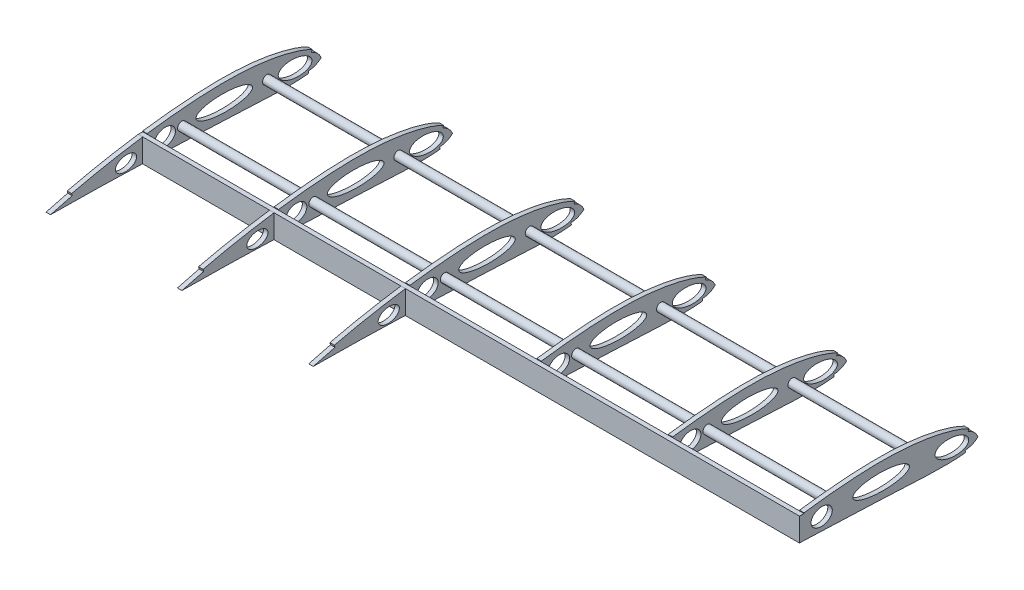
from build123d import *

# Parameters (mm, degrees)
SKETCH2_R           = 3
SPARS_DEPTH         = 467
SPARS_2_DEPTH       = 467
SKETCH2_9_R         = 3
SKETCH2_9_RX        = 20
SKETCH2_9_RY        = 6.002165883
SKETCH2_9_RX_2      = 12
SKETCH2_9_RY_2      = 6
SKETCH2_9_RX_3      = 7.5
SKETCH2_9_RY_3      = 5
BASE_WING_DEPTH     = 3.175
LPATTERN7_COUNT     = 3
LPATTERN7_PITCH     = 92.765
TRAILING_EDGE_DEPTH = 3.175
LEADING_EDGE_DEPTH  = 3.175
LPATTERN8_COUNT     = 3
LPATTERN8_PITCH     = 92.765
SKETCH2_10_W        = 3.17
SKETCH2_10_H        = 6.35
FACE_2_DEPTH        = 3.175
LPATTERN9_COUNT     = 3
LPATTERN9_PITCH     = 92.765
BALSA_SPAR_DEPTH    = 3.175
SKETCH13_R          = 3
SKETCH13_RX         = 7.5
SKETCH13_RY         = 6
SKETCH13_RX_2       = 20
SKETCH13_RY_2       = 6.002165883
SKETCH13_RX_3       = 12
BOSS_EXTRUDE3_DEPTH = 3.175
LPATTERN11_COUNT    = 3
LPATTERN11_PITCH    = 92.765


with BuildPart() as part:
    # Sketch2 → Spars (new body)
    with BuildSketch(Plane(origin=(0, 0, 0), x_dir=(0, 0, -1), z_dir=(1, 0, 0))):
        with Locations((-100, 7.63821329)):
            Circle(SKETCH2_R)
    extrude(amount=SPARS_DEPTH)



with BuildPart() as body_2:
    # Sketch2 → Spars 2 (new body)
    with BuildSketch(Plane(origin=(0, 0, 0), x_dir=(0, 0, -1), z_dir=(1, 0, 0))):
        with Locations((-40, 6.025907743)):
            Circle(SKETCH2_R)
    extrude(amount=SPARS_2_DEPTH)


with BuildPart() as part_1:
    add(part.part)

    add(body_2.part)  # Base Wing merges body 2
    # Sketch2<9> → Base Wing (add)
    with BuildSketch(Plane(origin=(0, 0, 0), x_dir=(0, 0, -1), z_dir=(1, 0, 0))):
        with BuildLine():
            Line((-197, 0.2561), (-197, -0.2561))
            add(Edge.make_bspline(
                [(-197, 0.2561), (-193.720051846, 1.148975952), (-187.175984135, 2.930418955), (-174.066319735, 6.169521771), (-157.672232572, 9.748336417), (-137.953262046, 13.276191525), (-118.249578108, 16.167933984), (-98.534915454, 18.230612316), (-78.82197056, 19.517084851), (-62.365367379, 19.530095579), (-49.225700657, 18.621049735), (-39.357636079, 17.423672707), (-29.468243934, 15.657889003), (-21.273253208, 13.534283636), (-14.706175676, 11.389530677), (-9.754447406, 9.364784755), (-5.529363038, 7.175075511), (-1.861986342, 4.555797112), (1.330488878, 0.343168608), (-2.115368024, -2.878563047), (-5.631524306, -4.143212528), (-9.819024618, -4.996795247), (-14.764452109, -5.430780599), (-21.338936338, -5.737920577), (-29.552055873, -5.714915584), (-39.404275191, -5.439217577), (-49.249542846, -4.914270065), (-62.382927675, -4.300031314), (-78.796855188, -3.511797532), (-98.500568162, -2.77163986), (-118.197951403, -1.949757861), (-137.897219395, -1.249725144), (-157.598065548, -0.734807161), (-174.016173684, -0.473368488), (-187.149700572, -0.301197616), (-193.716625954, -0.271132268), (-197, -0.2561)],
                knots=[0, 0, 0, 0, 0.025304886, 0.050487653, 0.100520433, 0.150190716, 0.199586607, 0.248740009, 0.297715539, 0.346600594, 0.371102737, 0.395726297, 0.420570145, 0.445825119, 0.458702216, 0.471919982, 0.485786003, 0.493461051, 0.506863029, 0.51614777, 0.522766003, 0.535269014, 0.547551134, 0.559786371, 0.584228898, 0.60868081, 0.633151284, 0.657621757, 0.706558114, 0.75548187, 0.804405627, 0.853320224, 0.902221408, 0.951113136, 0.975557228, 1, 1, 1, 1], degree=3))
        make_face()
        with Locations((-100, 7.63821329)):
            Circle(SKETCH2_9_R, mode=Mode.SUBTRACT)
        with Locations((-40, 6.025907743)):
            Circle(SKETCH2_9_R, mode=Mode.SUBTRACT)
        with Locations(Location((-70, 6.832060517), (0, 0, -1.53926796))):
            Ellipse(SKETCH2_9_RX, SKETCH2_9_RY, mode=Mode.SUBTRACT)
        with Locations(Location((-20, 3.012953872), (0, 0, 171.432944338))):
            Ellipse(SKETCH2_9_RX_2, SKETCH2_9_RY_2, mode=Mode.SUBTRACT)
        with Locations(Location((-111.962967983, 6.696195754), (0, 0, 4.502434883))):
            Ellipse(SKETCH2_9_RX_3, SKETCH2_9_RY_2, mode=Mode.SUBTRACT)
        with Locations(Location((-139.378102944, 4.537405566), (0, 0, 4.502434883))):
            Ellipse(SKETCH2_9_RX_3, SKETCH2_9_RY_3, mode=Mode.SUBTRACT)
    base_wing = extrude(amount=BASE_WING_DEPTH)

    # LPattern7: Base Wing ×3
    with Locations(*[(i * LPATTERN7_PITCH, 0, 0) for i in range(1, LPATTERN7_COUNT)]):
        add(base_wing)

    # Sketch3 → Trailing Edge (cut)
    with BuildSketch(Plane(origin=(3.175, 0, 0), x_dir=(0, 0, -1), z_dir=(1, 0, 0))):
        Polygon((-197.521386185, 1.761006393), (-196.726819632, -1.312963189), (-177.363231712, 3.692180452), (-178.157798265, 6.766150034), align=None)
    trailing_edge = extrude(amount=-TRAILING_EDGE_DEPTH, mode=Mode.SUBTRACT)

    # Sketch3<8> → Leading Edge (cut)
    with BuildSketch(Plane(origin=(3.175, 0, 0), x_dir=(0, 0, -1), z_dir=(1, 0, 0))):
        with BuildLine():
            Line((-7.865488579, 8.353118318), (-8.590989592, 6.941096884))
            add(Edge.make_bspline(
                [(-8.590989592, 6.941096884), (-3.637826546, 5.099470073), (-1.56978699, 0.236484789)],
                knots=[0, 0, 0, 1, 1, 1], degree=2))
            add(Edge.make_bspline(
                [(-10.641129315, -3.412295784), (-5.424782695, -3.280153074), (-1.56978699, 0.236484789)],
                knots=[0, 0, 0, 1, 1, 1], degree=2))
            Line((-10.641129315, -3.412295784), (-10.433219808, -4.986122295))
            add(Edge.make_bspline(
                [(-7.865488579, 8.353118318), (-3.743622137, 9.33160318), (8.448086316, -1.578694496), (-6.896479431, -7.243548849), (-10.433219808, -4.986122295)],
                knots=[0, 0, 0, 0, 0.498139943, 1, 1, 1, 1], degree=3))
        make_face()
    leading_edge = extrude(amount=-LEADING_EDGE_DEPTH, mode=Mode.SUBTRACT)

    # LPattern8: Trailing Edge, Leading Edge ×3
    with Locations(*[(i * LPATTERN8_PITCH, 0, 0) for i in range(1, LPATTERN8_COUNT)]):
        add(trailing_edge, mode=Mode.SUBTRACT)
        add(leading_edge, mode=Mode.SUBTRACT)

    # Sketch2<10> → Face 2 (cut)
    with BuildSketch(Plane(origin=(0, 0, 0), x_dir=(0, 0, -1), z_dir=(1, 0, 0))):
        with Locations((-126.024822972, 12.036556588)):
            Rectangle(SKETCH2_10_W, SKETCH2_10_H)
    face_2 = extrude(amount=FACE_2_DEPTH, mode=Mode.SUBTRACT)

    # LPattern9: Face 2 ×3
    with Locations(*[(i * LPATTERN9_PITCH, 0, 0) for i in range(1, LPATTERN9_COUNT)]):
        add(face_2, mode=Mode.SUBTRACT)

    # Sketch12 → Balsa Spar (add)
    with BuildSketch(Plane(origin=(0, 0, 127.609822972), x_dir=(-1, 0, 0), z_dir=(0, 0, -1))):
        Polygon((0, 14.762903067), (0, 8.861556588), (-3.175, 8.861556588), (-3.175, -1.738443412), (-92.765, -1.738443412), (-92.765, 8.861556588), (-95.94, 8.861556588), (-95.94, -1.738443412), (-185.53, -1.738443412), (-185.53, 8.861556588), (-188.705, 8.861556588), (-188.705, -1.738443412), (-278.295, -1.738443412), (-278.295, 8.861556588), (-281.47, 8.861556588), (-281.47, -1.738443412), (-371.06, -1.738443412), (-371.06, 8.861556588), (-374.235, 8.861556588), (-374.235, -1.738443412), (-463.825, -1.738443412), (-463.825, 8.861556588), (-467, 8.861556588), (-467, 14.762903067), align=None)
    extrude(amount=BALSA_SPAR_DEPTH)

    # Sketch13 → Boss-Extrude3 (add)
    with BuildSketch(Plane(origin=(278.295, 0, 0), x_dir=(0, 0, -1), z_dir=(1, 0, 0))):
        with BuildLine():
            Line((-127.609822972, 8.861556588), (-124.439822972, 8.861556588))
            Line((-124.439822972, 8.861556588), (-124.439822972, 14.762903067))
            Line((-124.439822972, 14.762903067), (-124.439822972, 15.211556588))
            add(Edge.make_bspline(
                [(-7.865488579, 8.353118318), (-8.519158094, 8.688975752), (-10.79968546, 9.792179267), (-14.706175676, 11.389530677), (-21.273253208, 13.534283636), (-29.468243934, 15.657889003), (-39.357636079, 17.423672707), (-49.225700657, 18.621049735), (-62.365367379, 19.530095579), (-78.82197056, 19.517084851), (-98.534915454, 18.230612316), (-113.735622282, 16.640213883), (-122.361603977, 15.49925717), (-124.439822972, 15.211556588)],
                knots=[0.183968648, 0.183968648, 0.183968648, 0.183968648, 0.189399506, 0.202617272, 0.215494368, 0.240749342, 0.26559319, 0.29021675, 0.314718893, 0.363603948, 0.412579478, 0.46173288, 0.47735084, 0.47735084, 0.47735084, 0.47735084], degree=3))
            Line((-7.865488579, 8.353118318), (-8.590989614, 6.941096892))
            add(Edge.make_bspline(
                [(-1.569786954, 0.236484822), (-3.637826537, 5.099470096), (-8.590989614, 6.941096892)],
                knots=[0, 0, 0, 1, 1, 1], degree=2))
            add(Edge.make_bspline(
                [(-10.641129315, -3.412295784), (-5.424782671, -3.280153073), (-1.569786954, 0.236484822)],
                knots=[0, 0, 0, 1, 1, 1], degree=2))
            Line((-10.641129315, -3.412295784), (-10.433219789, -4.986122293))
            add(Edge.make_bspline(
                [(-124.434822972, -1.735589843), (-122.356463195, -1.811471166), (-113.710907834, -2.136981732), (-98.500568162, -2.77163986), (-78.796855188, -3.511797532), (-62.382927675, -4.300031314), (-49.249542846, -4.914270065), (-39.404275191, -5.439217577), (-29.552055873, -5.714915584), (-21.338936338, -5.737920577), (-14.96002477, -5.439917161), (-11.878437231, -5.177041968), (-10.433219789, -4.986122293)],
                knots=[0.536725435, 0.536725435, 0.536725435, 0.536725435, 0.552207775, 0.601131531, 0.650055287, 0.698991644, 0.723462118, 0.747932591, 0.772384503, 0.796827031, 0.809062268, 0.819887967, 0.819887967, 0.819887967, 0.819887967], degree=3))
            Line((-124.434822972, -1.735589843), (-127.609822972, -1.738443412))
            Line((-127.609822972, -1.738443412), (-127.609822972, 8.861556588))
        make_face()
        with Locations((-40, 6.025907743)):
            Circle(SKETCH13_R, mode=Mode.SUBTRACT)
        with Locations((-100, 7.63821329)):
            Circle(SKETCH13_R, mode=Mode.SUBTRACT)
        with Locations(Location((-111.962967983, 6.696195754), (0, 0, 4.502434883))):
            Ellipse(SKETCH13_RX, SKETCH13_RY, mode=Mode.SUBTRACT)
        with Locations(Location((-70, 6.832060517), (0, 0, -1.53926796))):
            Ellipse(SKETCH13_RX_2, SKETCH13_RY_2, mode=Mode.SUBTRACT)
        with Locations(Location((-20, 3.012953872), (0, 0, -8.567055662))):
            Ellipse(SKETCH13_RX_3, SKETCH13_RY, mode=Mode.SUBTRACT)
    boss_extrude3 = extrude(amount=BOSS_EXTRUDE3_DEPTH)

    # LPattern11: Boss-Extrude3 ×3
    with Locations(*[(i * LPATTERN11_PITCH, 0, 0) for i in range(1, LPATTERN11_COUNT)]):
        add(boss_extrude3)


solid = part_1.part
